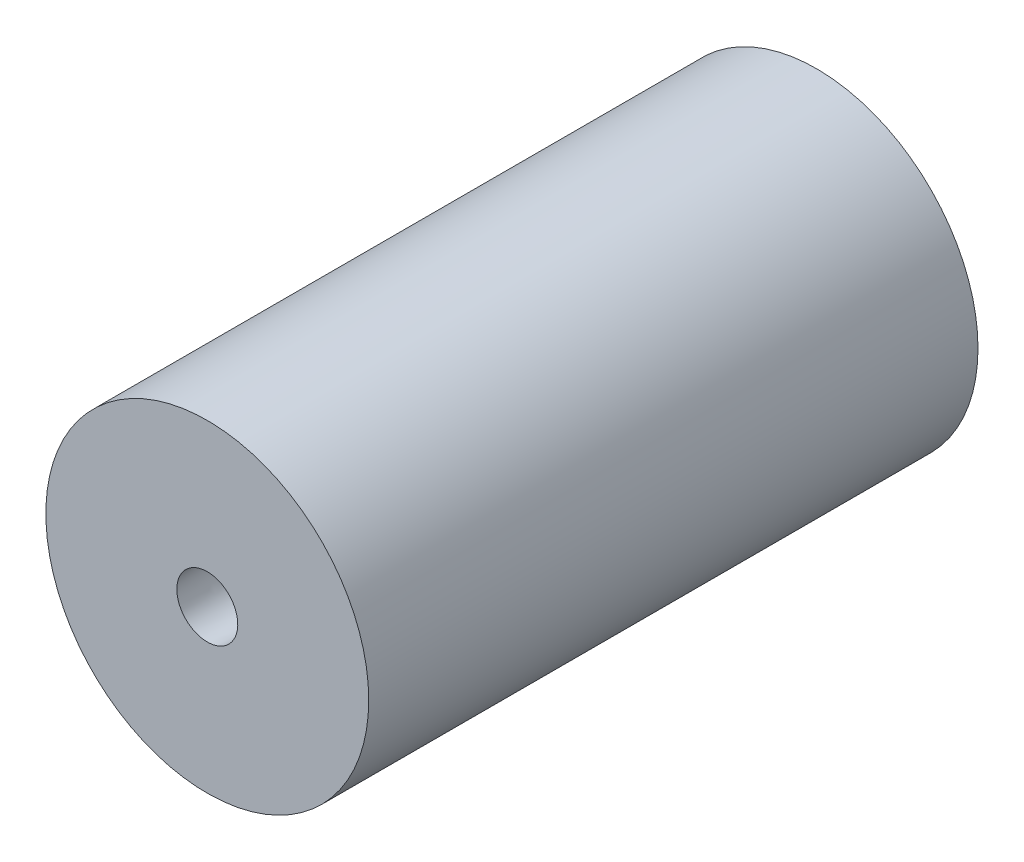
from build123d import *

# Parameters (mm, degrees)
SKETCH1_R           = 2.65
BOSS_EXTRUDE1_DEPTH = 10


with BuildPart() as part:
    # Sketch1 → Boss-Extrude1 (new body)
    with BuildSketch(Plane.XY):
        Circle(SKETCH1_R)
    extrude(amount=BOSS_EXTRUDE1_DEPTH)

    # Cut-Loft1: read off the stored shape, not the designer's step
    # Cut-Loft1: loft between two sections, ruled curve by curve
    cut_loft1_from = [
        Edge.make_bspline([(0.957982838, 0.286825526, 0), (0.384331786, 2.202791202, 0), (-1.53163389, 1.62914015, 0), (-0.957982838, -0.286825526, 0), (-0.384331786, -2.202791202, 0), (1.53163389, -1.62914015, 0), (0.957982838, 0.286825526, 0)], [0, 0, 0, 0, 0.5, 0.5, 0.5, 1, 1, 1, 1], 3, [1, 0.333333333, 0.333333333, 1, 0.333333333, 0.333333333, 1]),
    ]
    cut_loft1_to = [
        Edge.make_bspline([(0.462299616, -0.190470641, 10), (0.843240898, 0.734128591, 10), (-0.081358334, 1.115069873, 10), (-0.462299616, 0.190470641, 10), (-0.843240898, -0.734128591, 10), (0.081358334, -1.115069873, 10), (0.462299616, -0.190470641, 10)], [0, 0, 0, 0, 0.5, 0.5, 0.5, 1, 1, 1, 1], 3, [1, 0.333333333, 0.333333333, 1, 0.333333333, 0.333333333, 1]),
    ]
    cut_loft1 = Solid(Shell([*[Face.make_surface_from_curves(cut_loft1_from[k], cut_loft1_to[k]) for k in range(1)], Face(Wire(cut_loft1_from)), Face(Wire(cut_loft1_to))]))
    add(cut_loft1, mode=Mode.SUBTRACT)


solid = part.part
